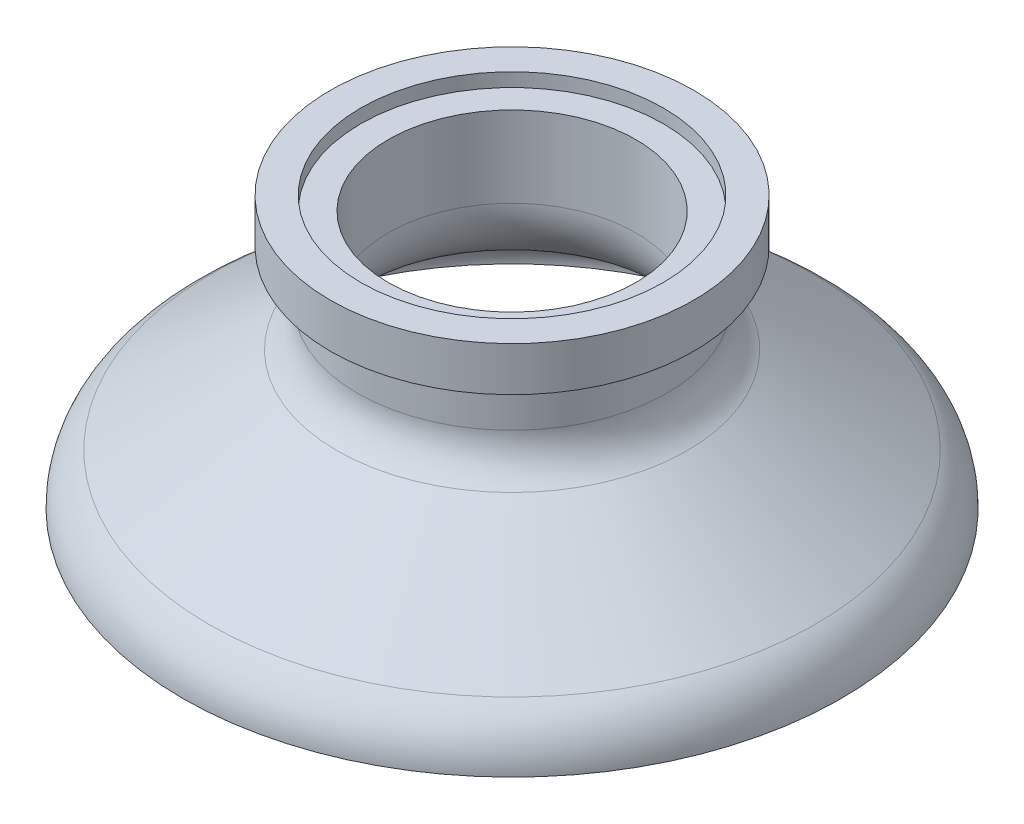
from build123d import *


# Read off the part's stored shape, not the designer's step: Shell1
with BuildPart() as part:
    # Sketch1 → Revolve1 (revolve)
    with BuildSketch(Plane.XY, mode=Mode.PRIVATE) as revolve1_sk:
        with BuildLine():
            Line((0, 0), (55.850610629, 0))
            ThreePointArc((55.850610629, 0), (64.83086675, 3.719743879), (68.550610629, 12.7))
            Line((68.550610629, 12.7), (68.550610629, 135.537090781))
            ThreePointArc((68.550610629, 135.537090781), (67.07437947, 141.479902659), (62.988876295, 146.041145392))
            Line((62.988876295, 146.041145392), (36.426242146, 164.092378593))
            ThreePointArc((36.426242146, 164.092378593), (33.255344861, 167.632513451), (32.109591896, 172.244930881))
            Line((32.109591896, 172.244930881), (32.109591896, 182.693006016))
            Line((32.109591896, 182.693006016), (37.812538782, 182.693006016))
            Line((37.812538782, 182.693006016), (37.812538782, 191.889991998))
            Line((37.812538782, 191.889991998), (0, 191.889991998))
            Line((0, 191.889991998), (0, 0))
        make_face()
    revolve(revolve1_sk.sketch.rotate(Axis((0, 191.889991998, 0), (0, -1, 0)), 90), axis=Axis((0, 191.889991998, 0), (0, -1, 0)))

    # Shell1 outline → Shell1 (revolve, cut)
    with BuildSketch(Plane.XY):
        with BuildLine():
            Line((68.550610629, 135.537090781), (62.200610629, 135.537090781))
            ThreePointArc((62.200610629, 135.537090781), (61.462495049, 138.50849672), (59.419743462, 140.789118087))
            Line((59.419743462, 140.789118087), (32.857109313, 158.840351287))
            ThreePointArc((32.857109313, 158.840351287), (27.643460441, 164.661107512), (25.759591896, 172.244930881))
            Line((25.759591896, 172.244930881), (25.759591896, 189.043006016))
            Line((25.759591896, 189.043006016), (31.462538782, 189.043006016))
            Line((31.462538782, 189.043006016), (31.462538782, 191.889991998))
            Line((31.462538782, 191.889991998), (0, 191.889991998))
            Line((0, 191.889991998), (0, 0))
            Line((0, 0), (55.850610629, 0))
            ThreePointArc((55.850610629, 0), (64.83086675, 3.719743879), (68.550610629, 12.7))
            Line((68.550610629, 12.7), (68.550610629, 135.537090781))
        make_face()
    revolve(axis=Axis((0, 0, 0), (0, 1, 0)), mode=Mode.SUBTRACT)


solid = part.part
